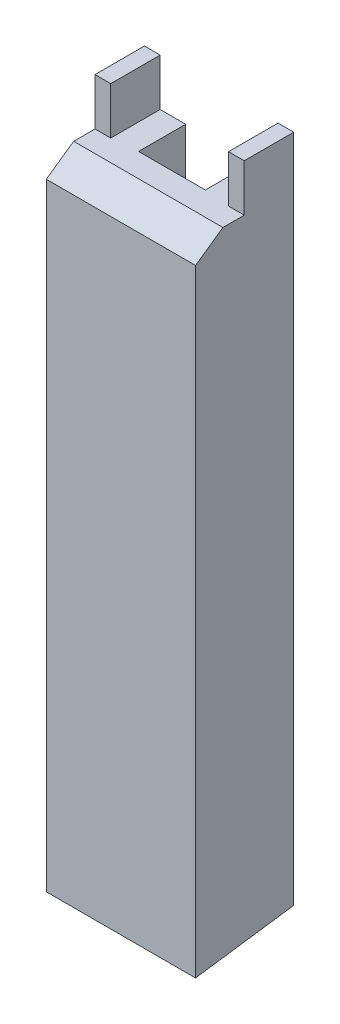
from build123d import *

# Parameters (mm, degrees)
SKETCH1_W           = 19
SKETCH1_H           = 81
BOSS_EXTRUDE1_DEPTH = 12.5
SKETCH2_W           = 8.5
SKETCH2_H           = 81
CUT_EXTRUDE1_DEPTH  = 6
SKETCH3_W           = 31.784398885
SKETCH3_H           = 20.084620154
CUT_EXTRUDE2_DEPTH  = 82.482700732
SKETCH4_W           = 27.793270948
SKETCH4_H           = 15.723744485
CUT_EXTRUDE3_DEPTH  = 82.989825664
SKETCH5_W           = 2
SKETCH5_H           = 6.3
BOSS_EXTRUDE2_DEPTH = 6


with BuildPart() as part:
    # Sketch1 → Boss-Extrude1 (new body)
    with BuildSketch(Plane.XY):
        with Locations((-0.214285714, -27.308823529)):
            Rectangle(SKETCH1_W, SKETCH1_H)
    extrude(amount=BOSS_EXTRUDE1_DEPTH)

    # Sketch2 → Cut-Extrude1 (cut)
    with BuildSketch(Plane(origin=(0, 0, 0), x_dir=(-1, 0, 0), z_dir=(0, 0, -1))):
        with Locations((0.214285714, -27.308823529)):
            Rectangle(SKETCH2_W, SKETCH2_H)
    extrude(amount=-CUT_EXTRUDE1_DEPTH, mode=Mode.SUBTRACT)

    # Sketch3 → Cut-Extrude2 (cut, through all)
    with BuildSketch(Plane(origin=(0, -64.772690644, -9.103208009), x_dir=(1, 0, 0), z_dir=(0, -0.9902680687415703, -0.13917310096006574))):
        with Locations((-0.737280551, 17.487835558)):
            Rectangle(SKETCH3_W, SKETCH3_H)
    extrude(amount=CUT_EXTRUDE2_DEPTH, mode=Mode.SUBTRACT)

    # Sketch4 → Cut-Extrude3 (cut, through all)
    with BuildSketch(Plane(origin=(0, 13.08618706, 9.163046826), x_dir=(-1, 0, 0), z_dir=(0, 0.819152044288991, 0.5735764363510473))):
        with Locations((0.087709147, 3.410086516)):
            Rectangle(SKETCH4_W, SKETCH4_H)
    extrude(amount=CUT_EXTRUDE3_DEPTH, mode=Mode.SUBTRACT)

    # Sketch5 → Boss-Extrude2 (add)
    with BuildSketch(Plane(origin=(0, 13.191176471, 0), x_dir=(1, 0, 0), z_dir=(0, 1, 0))):
        with Locations((-8.714285714, -3.15)):
            Rectangle(SKETCH5_W, SKETCH5_H)
        with Locations((8.285714286, -3.15)):
            Rectangle(SKETCH5_W, SKETCH5_H)
    extrude(amount=BOSS_EXTRUDE2_DEPTH)


solid = part.part
